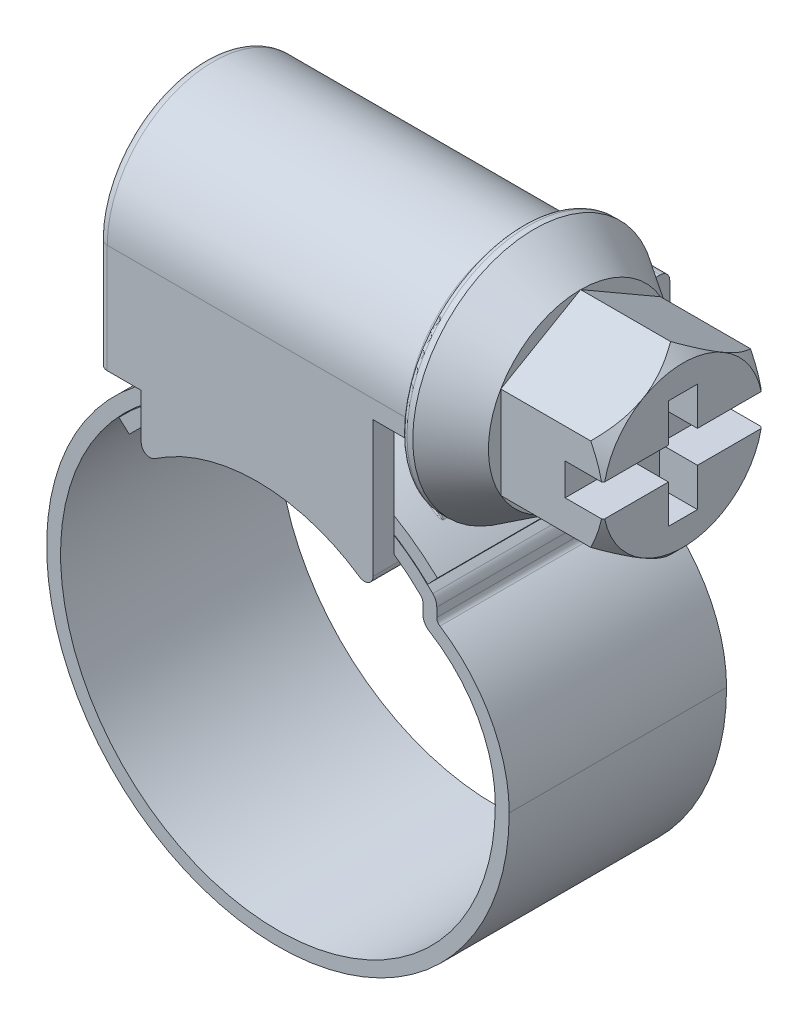
from build123d import *

# Parameters (mm, degrees)
EXTRUDE_THIN1_DEPTH      = 4.7625
BOSS_EXTRUDE1_DEPTH      = 6.98845
BOSS_EXTRUDE1_DEPTH_BACK = 6.98845
SHELL2_START             = -6.07845
SHELL2_DEPTH             = 12.1569
BOSS_EXTRUDE2_DEPTH      = 5.6725
BOSS_EXTRUDE2_DEPTH_BACK = 6.3921
BOSS_EXTRUDE9_START      = -0.91
BOSS_EXTRUDE9_DEPTH      = 0.91
BOSS_EXTRUDE10_START     = 0.91
BOSS_EXTRUDE10_DEPTH     = 0.91
CUT_EXTRUDE3_DEPTH       = 23.158883849
CUT_EXTRUDE3_DEPTH_BACK  = 23.158883849
FILLET3_R                = 0.419307
FILLET8_R                = 0.838614
CHAMFER2_SIZE            = 0.762
CUT_SWEEP1_PITCH         = 1.651
CUT_SWEEP1_HEIGHT        = 19.05
CUT_SWEEP1_RADIUS        = 3.511635616
CUT_SWEEP1_START_ANGLE   = 90
SKETCH31_W               = 0.91
SKETCH31_H               = 2.38125
BOSS_EXTRUDE7_DEPTH      = 7.0231
SKETCH15_OUTSIDE_W       = 87.232
SKETCH15_OUTSIDE_H       = 102.659
SKETCH15_OUTSIDE_R       = 3.5
CUT_EXTRUDE1_DEPTH       = 32.166369371
CUT_EXTRUDE1_DRAFT       = -45
SKETCH16_W               = 7
SKETCH16_H               = 1.4
CUT_EXTRUDE2_DEPTH       = 1.6625
SKETCH39_W               = 1.27
SKETCH39_H               = 4.7625
CUT_EXTRUDE6_DEPTH       = 1.6625
FILLET6_R                = 0.254
CUT_EXTRUDE4_DEPTH       = 25.696785833
CUT_EXTRUDE4_DEPTH_BACK  = 25.696785833
SKETCH35_W               = 1.90845
SKETCH35_H               = 3.96875
SKETCH32_W               = 1.905
SKETCH32_H               = 0.79375
BOSS_EXTRUDE11_DEPTH     = 8.25155
FILLET11_R               = 0.381
FILLET7_R                = 0.381
BOSS_EXTRUDE12_DEPTH     = 2.38125
CUT_EXTRUDE5_DEPTH       = 1.77165
FILLET13_R               = 0.0508
FILLET14_R               = 0.0508
FILLET9_R                = 0.3048
FILLET10_R               = 0.6096


# Read off the part's stored shape, not the designer's step: Shell2
with BuildPart() as part:
    # Sketch2 → Extrude-Thin1 (new, symmetric)
    with BuildSketch(Plane.XY):
        with BuildLine():
            ThreePointArc((-6.517564524, 6.045945143), (-0.121417695, 8.889170813), (6.35, 6.221703947))
            Line((6.35, 6.221703947), (6.35, 5.307303947))
            ThreePointArc((6.35, 5.307303947), (8.670660912, 3.092252423), (9.525, 0))
            ThreePointArc((9.525, 0), (-8.754618847, -3.752635587), (6.568092105, 6.898245509))
            Line((6.568092105, 6.898245509), (6.98845, 7.339733221))
            ThreePointArc((6.98845, 7.339733221), (-9.314914453, -3.992804265), (10.1346, 0))
            ThreePointArc((10.1346, 0), (9.286649104, 3.244959945), (6.9596, 5.660250452))
            Line((6.9596, 5.660250452), (6.9596, 6.465784407))
            ThreePointArc((6.9596, 6.465784407), (-0.00358871, 9.499599322), (-6.964483234, 6.460524239))
            Line((-6.964483234, 6.460524239), (-6.517564524, 6.045945143))
        make_face()
    extrude(amount=EXTRUDE_THIN1_DEPTH, both=True)

    # Sketch36 → Boss-Extrude12 (add, symmetric)
    with BuildSketch(Plane.XY.offset(1.026284713)):
        with BuildLine():
            Line((5.667988925, 8.984917883), (5.475217515, 9.10367184))
            ThreePointArc((5.475217515, 9.10367184), (5.426027619, 9.121342053), (5.373886922, 9.117704733))
            ThreePointArc((5.373886922, 9.117704733), (5.086735752, 8.970079873), (4.764865373, 8.944617104))
            ThreePointArc((4.764865373, 8.944617104), (5.315588387, 8.628710057), (5.84545, 8.27893903))
            ThreePointArc((5.84545, 8.27893903), (5.723413771, 8.577863857), (5.726100747, 8.900728649))
            ThreePointArc((5.726100747, 8.900728649), (5.705896382, 8.948933067), (5.667988925, 8.984917883))
        make_face()
    extrude(amount=BOSS_EXTRUDE12_DEPTH, both=True)

    # Sketch38 → Cut-Extrude5 (cut, symmetric)
    with BuildSketch(Plane.XY.offset(1.026284713)):
        with BuildLine():
            ThreePointArc((4.563064593, 8.360865178), (4.995853748, 8.109689904), (5.414854745, 7.836132534))
            ThreePointArc((5.414854745, 7.836132534), (5.254889687, 8.083417375), (5.148957601, 8.358220952))
            ThreePointArc((5.148957601, 8.358220952), (4.855874266, 8.329224886), (4.563064593, 8.360865178))
        make_face()
    extrude(amount=CUT_EXTRUDE5_DEPTH, both=True, mode=Mode.SUBTRACT)

    # Fillet13
    fillet13_edges = [part.edges().sort_by_distance(p)[0] for p in [
        (5.723413771, 8.577863857, -1.354965287),
        (5.705896382, 8.948933067, -1.354965287),
        (5.726100747, 8.900728649, 1.026284713),
        (5.57160322, 9.044294862, -1.354965287),
        (5.426027619, 9.121342053, -1.354965287),
        (5.086735752, 8.970079873, -1.354965287),
        (5.373886922, 9.117704733, 1.026284713),
        (5.723413771, 8.577863857, 3.407534713),
        (5.705896382, 8.948933067, 3.407534713),
        (5.57160322, 9.044294862, 3.407534713),
        (5.426027619, 9.121342053, 3.407534713),
        (5.086735752, 8.970079873, 3.407534713),
    ]]
    fillet(fillet13_edges, radius=FILLET13_R)
    fillet13_2_edges = [part.edges().sort_by_distance(p)[0] for p in [
        (5.84545, 8.27893903, 1.026284713),
        (5.315588387, 8.628710057, -1.354965287),
        (4.764865373, 8.944617104, 1.026284713),
        (5.315588387, 8.628710057, 3.407534713),
        (4.79921288, 8.926235091, 3.392738365),
        (5.813582941, 8.301347514, 3.392738365),
        (4.799211334, 8.926235922, -1.340168233),
        (5.813582941, 8.301347514, -1.340168939),
    ]]
    fillet(fillet13_2_edges, radius=FILLET13_R)

    # Fillet14
    fillet14_edges = [part.edges().sort_by_distance(p)[0] for p in [
        (4.855874266, 8.329224886, -0.745365287),
        (5.254889687, 8.083417375, -0.745365287),
        (4.855874266, 8.329224886, 2.797934713),
        (5.254889687, 8.083417375, 2.797934713),
    ]]
    fillet(fillet14_edges, radius=FILLET14_R)
    fillet14_2_edges = [part.edges().sort_by_distance(p)[0] for p in [
        (4.563064593, 8.360865178, 1.026284713),
        (4.995853748, 8.109689904, -0.745365287),
        (5.414854745, 7.836132534, 1.026284713),
        (4.995853748, 8.109689904, 2.797934713),
        (4.60636885, 8.337085282, 2.783145356),
        (5.374136088, 7.864113829, 2.78314606),
        (5.374137924, 7.864112573, -0.73057593),
        (4.60636885, 8.337085282, -0.73057593),
    ]]
    fillet(fillet14_2_edges, radius=FILLET14_R)

    # Fillet9
    fillet9_edges = [part.edges().sort_by_distance(p)[0] for p in [
        (6.35, 6.221703947, 0),
        (6.9596, 5.660250452, 0),
    ]]
    fillet(fillet9_edges, radius=FILLET9_R)

    # Fillet10
    fillet10_edges = [part.edges().sort_by_distance(p)[0] for p in [
        (6.35, 5.307303947, 0),
        (6.9596, 6.465784407, 0),
    ]]
    fillet(fillet10_edges, radius=FILLET10_R)


with BuildPart() as body_2:
    # Sketch3 → Boss-Extrude1 (new, two sides: drawn at the far end of the back side and taken through both)
    with BuildSketch(Plane(origin=(0, 0, 0), x_dir=(0, 0, -1), z_dir=(1, 0, 0)).offset(-BOSS_EXTRUDE1_DEPTH_BACK)):
        with BuildLine():
            Line((-5.6725, 10.1346), (-5.6725, 8.88335))
            Line((-5.6725, 8.88335), (-4.7625, 8.88335))
            Line((-4.7625, 8.88335), (-4.7625, 10.1346))
            Line((-4.7625, 10.1346), (6.4175, 10.1346))
            Line((6.4175, 10.1346), (6.4175, 8.88335))
            Line((6.4175, 8.88335), (7.3275, 8.88335))
            Line((7.3275, 8.88335), (7.3275, 10.1346))
            Line((7.3275, 10.1346), (7.3275, 12.05835))
            Line((7.3275, 12.05835), (3.619930574, 12.05835))
            Line((3.619930574, 12.05835), (3.619930574, 13.646235616))
            ThreePointArc((3.619930574, 13.646235616), (-1.026284713, 18.292450903), (-5.6725, 13.646235616))
            Line((-5.6725, 13.646235616), (-5.6725, 12.05835))
            Line((-5.6725, 12.05835), (-5.6725, 10.1346))
        make_face()
    extrude(amount=BOSS_EXTRUDE1_DEPTH + BOSS_EXTRUDE1_DEPTH_BACK)

    # Shell2 outline → Shell2 (cut)
    with BuildSketch(Plane.YZ.offset(SHELL2_START)):
        with BuildLine():
            Line((10.1346, -6.4175), (11.14835, -6.4175))
            Line((11.14835, -6.4175), (11.14835, -2.709930574))
            Line((11.14835, -2.709930574), (13.646235616, -2.709930574))
            ThreePointArc((13.646235616, -2.709930574), (17.382450903, 1.026284713), (13.646235616, 4.7625))
            Line((13.646235616, 4.7625), (10.1346, 4.7625))
            Line((10.1346, 4.7625), (10.1346, -6.4175))
        make_face()
    extrude(amount=SHELL2_DEPTH, mode=Mode.SUBTRACT)


with BuildPart() as body_3:
    # Sketch4 → Boss-Extrude2 (new, two sides: drawn at the far end of the back side and taken through both)
    with BuildSketch(Plane.XY.offset(-BOSS_EXTRUDE2_DEPTH_BACK)):
        with BuildLine():
            Line((-5.08, 6.143078692), (-5.08, 7.295594561))
            ThreePointArc((-5.08, 7.295594561), (0, 8.89), (5.08, 7.295594561))
            Line((5.08, 7.295594561), (5.08, 6.143078692))
            ThreePointArc((5.08, 6.143078692), (0, 7.9714375), (-5.08, 6.143078692))
        make_face()
    extrude(amount=BOSS_EXTRUDE2_DEPTH + BOSS_EXTRUDE2_DEPTH_BACK)


    add(body_2.part)  # Boss-Extrude9 merges body 2
    # Sketch6 → Boss-Extrude9 (add)
    with BuildSketch(Plane(origin=(0, 0, 4.7625), x_dir=(-1, 0, 0), z_dir=(0, 0, -1)).offset(BOSS_EXTRUDE9_START)):
        with BuildLine():
            Line((-5.08, 7.295594561), (-5.08, 11.14835))
            Line((-5.08, 11.14835), (5.08, 11.14835))
            Line((5.08, 11.14835), (5.08, 7.295594561))
            ThreePointArc((5.08, 7.295594561), (0, 8.89), (-5.08, 7.295594561))
        make_face()
    extrude(amount=BOSS_EXTRUDE9_DEPTH)

    # Sketch7 → Boss-Extrude10 (add)
    with BuildSketch(Plane.XY.offset(-6.3921).offset(BOSS_EXTRUDE10_START)):
        with BuildLine():
            Line((5.08, 11.12295), (-5.08, 11.12295))
            Line((-5.08, 11.12295), (-5.08, 7.295594561))
            ThreePointArc((-5.08, 7.295594561), (0, 8.89), (5.08, 7.295594561))
            Line((5.08, 7.295594561), (5.08, 11.12295))
        make_face()
    extrude(amount=-BOSS_EXTRUDE10_DEPTH)

    # Sketch25 → Cut-Extrude3 (cut, two sides: drawn at the far end of the back side and taken through both)
    with BuildSketch(Plane(origin=(0, 0, 0), x_dir=(0, 0, -1), z_dir=(1, 0, 0)).offset(-CUT_EXTRUDE3_DEPTH_BACK)):
        with BuildLine():
            Line((-3.407534713, 13.646235616), (-3.407534713, 10.1346))
            Line((-3.407534713, 10.1346), (1.354965287, 10.1346))
            Line((1.354965287, 10.1346), (1.354965287, 13.646235616))
            ThreePointArc((1.354965287, 13.646235616), (-1.026284713, 16.027485616), (-3.407534713, 13.646235616))
        make_face()
    extrude(amount=CUT_EXTRUDE3_DEPTH + CUT_EXTRUDE3_DEPTH_BACK, mode=Mode.SUBTRACT)

    # Fillet3
    fillet3_edges = [body_3.edges().sort_by_distance(p)[0] for p in [
        (-6.98845, 11.264792808, 5.6725),
        (-6.98845, 18.292450903, 1.026284713),
        (-6.98845, 12.852292808, -3.619930574),
        (0, 12.05835, -3.619930574),
        (-6.98845, 12.05835, -5.473715287),
        (0, 12.05835, -7.3275),
        (-6.98845, 10.47085, -7.3275),
        (6.98845, 11.264792808, 5.6725),
        (6.98845, 12.05835, -5.473715287),
        (6.98845, 12.852292808, -3.619930574),
        (6.98845, 18.292450903, 1.026284713),
    ]]
    fillet(fillet3_edges, radius=FILLET3_R)

    # Fillet8
    fillet8_edges = [body_3.edges().sort_by_distance(p)[0] for p in [
        (6.53345, 10.1346, -1.354965287),
        (-6.53345, 10.1346, -1.354965287),
        (6.53345, 10.1346, 3.407534713),
        (-6.53345, 10.1346, 3.407534713),
    ]]
    fillet(fillet8_edges, radius=FILLET8_R)

    # Sketch35 → Cut-Extrude4 (cut, two sides: drawn at the far end of the back side and taken through both)
    with BuildSketch(Plane.XY.offset(-CUT_EXTRUDE4_DEPTH_BACK)):
        with Locations((6.034225, 10.867725)):
            Rectangle(SKETCH35_W, SKETCH35_H)
    extrude(amount=CUT_EXTRUDE4_DEPTH + CUT_EXTRUDE4_DEPTH_BACK, mode=Mode.SUBTRACT)

    # Sketch32 → Boss-Extrude11 (add)
    with BuildSketch(Plane.ZY.offset(5.08)):
        with Locations((-5.4396, 12.455225)):
            Rectangle(SKETCH32_W, SKETCH32_H)
    extrude(amount=-BOSS_EXTRUDE11_DEPTH)

    # Fillet11
    fillet11_edges = [body_3.edges().sort_by_distance(p)[0] for p in [
        (-0.954225, 12.8521, -6.3921),
    ]]
    fillet(fillet11_edges, radius=FILLET11_R)

    # Fillet7
    fillet7_edges = [body_3.edges().sort_by_distance(p)[0] for p in [
        (-5.08, 6.143078692, -0.3598),
        (5.08, 6.143078692, -0.3598),
    ]]
    fillet(fillet7_edges, radius=FILLET7_R)


with BuildPart() as body_3_2:
    # Sketch10 → Revolve1 (revolve)
    with BuildSketch(Plane.XY.offset(1.026284713), mode=Mode.PRIVATE) as revolve1_sk:
        Polygon((-6.07845, 11.264985616), (-6.07845, 13.646235616), (6.07845, 13.646235616), (6.07845, 11.264985616), (6.07845, 10.1346), (-6.07845, 10.1346), align=None)
    revolve(revolve1_sk.sketch.rotate(Axis((-6.07845, 13.646235616, 1.026284713), (1, 0, 0)), 270), axis=Axis((-6.07845, 13.646235616, 1.026284713), (1, 0, 0)))

    # Chamfer2
    chamfer2_edges = [body_3_2.edges().sort_by_distance(p)[0] for p in [
        (-6.07845, 13.646235616, -2.485350903),
        (6.07845, 13.646235616, -2.485350903),
    ]]
    chamfer(chamfer2_edges, length=CHAMFER2_SIZE)

    # Cut-Sweep1: sweep along a helix
    with BuildLine() as cut_sweep1_path:
        add(Helix(CUT_SWEEP1_PITCH, CUT_SWEEP1_HEIGHT, CUT_SWEEP1_RADIUS, center=(6.07845, 13.646235616, 1.026284713), direction=(-1, 0, 0), mode=Mode.PRIVATE).rotate(Axis((6.07845, 13.646235616, 1.026284713), (-1, 0, 0)), CUT_SWEEP1_START_ANGLE))
    # Sketch30 → Cut-Sweep1 (sweep, cut)
    with BuildSketch(Plane.XY):
        Polygon((5.31645, 17.157871231), (6.84045, 17.157871231), (6.33245, 16.277989421), (5.82445, 16.277989421), align=None)
    sweep(path=cut_sweep1_path.line, is_frenet=True, mode=Mode.SUBTRACT)

    # Sketch31 → Revolve3 (revolve)
    with BuildSketch(Plane.XY.offset(1.026284713), mode=Mode.PRIVATE) as revolve3_sk:
        with Locations((-6.53345, 12.455610616)):
            Rectangle(SKETCH31_W, SKETCH31_H)
        with Locations((6.53345, 12.455610616)):
            Rectangle(SKETCH31_W, SKETCH31_H)
    revolve(revolve3_sk.sketch.rotate(Axis((6.98845, 13.646235616, 1.026284713), (-1, 0, 0)), 260.153703235), axis=Axis((6.98845, 13.646235616, 1.026284713), (-1, 0, 0)))

    # Sketch13 → Boss-Extrude7 (add)
    with BuildSketch(Plane(origin=(6.98845, 0, 0), x_dir=(0, 0, -1), z_dir=(1, 0, 0))):
        Polygon((-1.026284713, 17.6876875), (-4.526284713, 15.666961558), (-4.526284713, 11.625509674), (-1.026284713, 9.604783731), (2.473715287, 11.625509674), (2.473715287, 15.666961558), align=None)
    extrude(amount=BOSS_EXTRUDE7_DEPTH)


with BuildPart() as cut_extrude1_tool:
    # Sketch15 outside → Cut-Extrude1 (with draft: the straight prism first)
    with BuildSketch(Plane(origin=(14.01155, 0, 0), x_dir=(0, 0, -1), z_dir=(1, 0, 0))):
        with Locations((0.828, 4.0785)):
            Rectangle(SKETCH15_OUTSIDE_W, SKETCH15_OUTSIDE_H)
        with Locations((-1.026284713, 13.646235616)):
            Circle(SKETCH15_OUTSIDE_R, mode=Mode.SUBTRACT)
    extrude(amount=-CUT_EXTRUDE1_DEPTH)
    # Cut-Extrude1: the draft: its side faces are tilted about the plane it starts from
    cut_extrude1_sides = [cut_extrude1_tool.faces().sort_by_distance(p)[0] for p in [
        (-2.071634685, -47.251, -0.828),
        (-2.071634685, 4.0785, -44.444),
        (-2.071634685, 55.408, -0.828),
        (-2.071634685, 4.0785, 42.788),
        (-2.071634685, 13.646235616, 4.526284713),
    ]]
    draft(cut_extrude1_sides, Plane(origin=(14.01155, 0, 0), x_dir=(0, 0, -1), z_dir=(1, 0, 0)), CUT_EXTRUDE1_DRAFT)


with BuildPart() as body_3_2_1:
    add(body_3_2.part)

    # Cut-Extrude1: cut by cut_extrude1_tool
    add(cut_extrude1_tool.part, mode=Mode.SUBTRACT)

    # Sketch16 → Cut-Extrude2 (cut)
    with BuildSketch(Plane(origin=(14.01155, 0, 0), x_dir=(0, 0, -1), z_dir=(1, 0, 0))):
        with Locations((-1.026284713, 13.646235616)):
            Rectangle(SKETCH16_W, SKETCH16_H)
    extrude(amount=-CUT_EXTRUDE2_DEPTH, mode=Mode.SUBTRACT)

    # Sketch39 → Cut-Extrude6 (cut)
    with BuildSketch(Plane(origin=(14.01155, 0, 0), x_dir=(0, 0, -1), z_dir=(1, 0, 0))):
        with Locations((-1.026284713, 13.646235616)):
            Rectangle(SKETCH39_W, SKETCH39_H)
    extrude(amount=-CUT_EXTRUDE6_DEPTH, mode=Mode.SUBTRACT)

    # Sketch19 → Revolve2 (revolve)
    with BuildSketch(Plane.XY.offset(1.026284713), mode=Mode.PRIVATE) as revolve2_sk:
        Polygon((9.52845, 13.646235616), (9.52845, 17.6876875), (7.49645, 18.9714375), (6.98845, 18.9714375), (6.98845, 13.646235616), align=None)
    revolve(revolve2_sk.sketch.rotate(Axis((6.98845, 13.646235616, 1.026284713), (1, 0, 0)), 29.828977026), axis=Axis((6.98845, 13.646235616, 1.026284713), (1, 0, 0)))

    # Fillet6
    fillet6_edges = [body_3_2_1.edges().sort_by_distance(p)[0] for p in [
        (6.98845, 9.026548425, -1.622538681),
    ]]
    fillet(fillet6_edges, radius=FILLET6_R)


solid = Compound([part.part, body_3.part, body_3_2_1.part])
